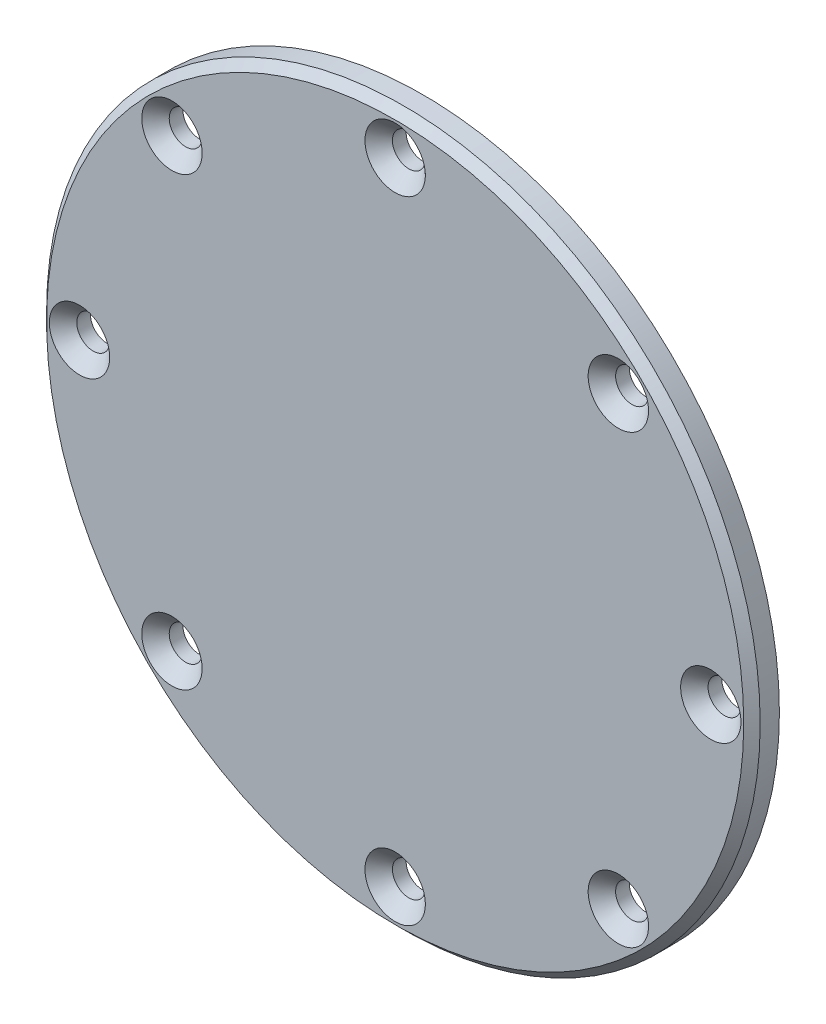
from build123d import *

# Parameters (mm, degrees)
SKETCH_1_R               = 26
EXTRUDE_1_DEPTH          = 2
CHAMFER_2_SIZE           = 0.6
PATTERN_CIRCULAR_1_COUNT = 8


with BuildPart() as part:
    # Эскиз1 → Бобышка-Вытянуть1 (new body)
    with BuildSketch(Plane.XY):
        Circle(SKETCH_1_R)
    extrude(amount=EXTRUDE_1_DEPTH)

    # Фаска2
    chamfer_2_edges = [part.edges().sort_by_distance(p)[0] for p in [
        (-26, 0, 2),
    ]]
    chamfer(chamfer_2_edges, length=CHAMFER_2_SIZE)

    # Эскиз3 → Зенковка для винта с полупотайной головкой M21 (revolve, cut)
    with BuildSketch(Plane(origin=(-23, 0, 2), x_dir=(0, -1, 0), z_dir=(1, 0, 0))):
        Polygon((0, 0), (0, 6.721032743), (1.2, 6), (1.2, 1), (2.2, 0), align=None)
    hole_wizard_m21 = revolve(axis=Axis((-23, 0, 8.35), (0, 0, -1)), mode=Mode.SUBTRACT)

    # Круговой массив1: Зенковка для винта с полупотайной головкой M21 ×8 about axis
    pattern_circular_1_axis = Axis((0, 0, 2), (0, 0, 1))
    for i in range(1, PATTERN_CIRCULAR_1_COUNT):
        add(hole_wizard_m21.rotate(pattern_circular_1_axis, i * 360 / PATTERN_CIRCULAR_1_COUNT), mode=Mode.SUBTRACT)


solid = part.part
